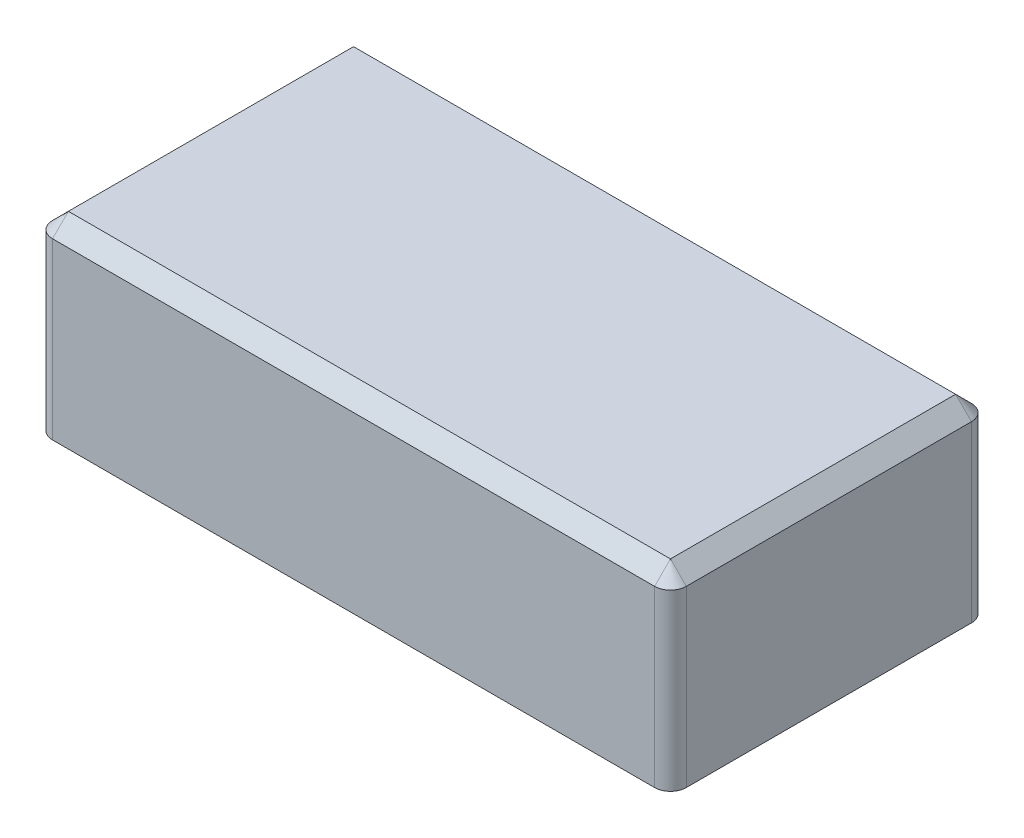
from build123d import *

# Parameters (mm, degrees)
DODANIE_WYCI_GNI_CIE1_DEPTH = 100
ZAOKR_GLENIE4_R             = 5
ZAOKR_GLENIE5_SIZE          = 5


with BuildPart() as part:
    # Szkic 3D1 → Dodanie-wyciągnięcie1 (new body)
    with BuildSketch(Plane(origin=(0, 0, 0), x_dir=(0.9578262852211514, 0.2873478855663454, 0), z_dir=(0, 0, -1))):
        Polygon((0, 0), (191.565257044, 57.469577113), (208.806130178, 0), (17.240873134, -57.469577113), align=None)
    extrude(amount=-DODANIE_WYCI_GNI_CIE1_DEPTH)

    # Zaokrąglenie4
    zaokr_glenie4_edges = [part.edges().sort_by_distance(p)[0] for p in [
        (200, 30, 0),
        (200, 30, 100),
        (0, 30, 0),
        (0, 30, 100),
    ]]
    fillet(zaokr_glenie4_edges, radius=ZAOKR_GLENIE4_R)

    # Zaokrąglenie5
    zaokr_glenie5_edges = [part.edges().sort_by_distance(p)[0] for p in [
        (200, 60, 50),
        (100, 60, 100),
        (100, 60, 0),
        (0, 60, 50),
        (1.464466094, 60, 98.535533906),
        (1.464466094, 60, 1.464466094),
        (198.535533906, 60, 98.535533906),
        (198.535533906, 60, 1.464466094),
    ]]
    chamfer(zaokr_glenie5_edges, length=ZAOKR_GLENIE5_SIZE - 0.0001)  # a hair under: the kernel refuses the full size


solid = part.part
